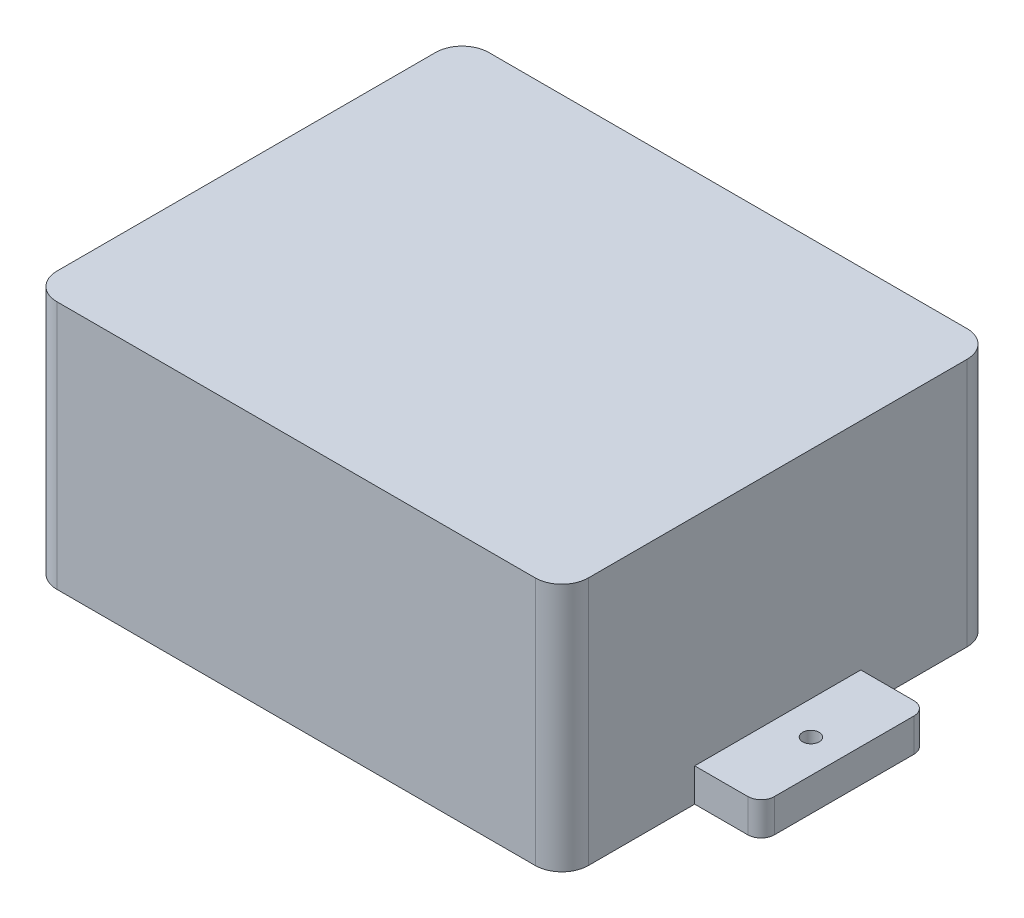
from build123d import *

# Parameters (mm, degrees)
SKETCH2_W           = 101.6
SKETCH2_H           = 82.55
BOSS_EXTRUDE1_DEPTH = 47.625
FILLET1_R           = 5.08
SKETCH4_W           = 12.7
SKETCH4_H           = 31.75
BOSS_EXTRUDE2_DEPTH = 6.35
SKETCH3_W           = 12.7
SKETCH3_H           = 31.75
BOSS_EXTRUDE3_DEPTH = 6.35
FILLET2_R           = 2.54
SKETCH5_W           = 31.75
SKETCH5_H           = 12.7
BOSS_EXTRUDE4_DEPTH = 6.35
FILLET3_R           = 2.54
SKETCH6_R           = 1.5875
CUT_EXTRUDE1_DEPTH  = 9.398
SKETCH7_R           = 1.5875
CUT_EXTRUDE2_DEPTH  = 9.398
SKETCH8_R           = 1.5875
CUT_EXTRUDE3_DEPTH  = 9.398


with BuildPart() as part:
    # Sketch2 → Boss-Extrude1 (new body)
    with BuildSketch(Plane(origin=(0, 0, 0), x_dir=(1, 0, 0), z_dir=(0, 1, 0))):
        Rectangle(SKETCH2_W, SKETCH2_H)
    extrude(amount=BOSS_EXTRUDE1_DEPTH)

    # Fillet1
    fillet1_edges = [part.edges().sort_by_distance(p)[0] for p in [
        (50.8, 23.8125, 41.275),
        (50.8, 23.8125, -41.275),
        (-50.8, 23.8125, 41.275),
        (-50.8, 23.8125, -41.275),
    ]]
    fillet(fillet1_edges, radius=FILLET1_R)

    # Sketch4 → Boss-Extrude2 (add)
    with BuildSketch(Plane(origin=(0, 0, 0), x_dir=(1, 0, 0), z_dir=(0, 1, 0))):
        with Locations((-57.15, 0)):
            Rectangle(SKETCH4_W, SKETCH4_H)
    extrude(amount=BOSS_EXTRUDE2_DEPTH)

    # Sketch3 → Boss-Extrude3 (add)
    with BuildSketch(Plane(origin=(0, 0, 0), x_dir=(1, 0, 0), z_dir=(0, 1, 0))):
        with Locations((57.15, 0)):
            Rectangle(SKETCH3_W, SKETCH3_H)
    extrude(amount=BOSS_EXTRUDE3_DEPTH)

    # Fillet2
    fillet2_edges = [part.edges().sort_by_distance(p)[0] for p in [
        (-63.5, 3.175, 15.875),
        (-63.5, 3.175, -15.875),
        (63.5, 3.175, -15.875),
        (63.5, 3.175, 15.875),
    ]]
    fillet(fillet2_edges, radius=FILLET2_R)

    # Sketch5 → Boss-Extrude4 (add)
    with BuildSketch(Plane(origin=(0, 0, 0), x_dir=(1, 0, 0), z_dir=(0, 1, 0))):
        with Locations((0, 47.625)):
            Rectangle(SKETCH5_W, SKETCH5_H)
    extrude(amount=BOSS_EXTRUDE4_DEPTH)

    # Fillet3
    fillet3_edges = [part.edges().sort_by_distance(p)[0] for p in [
        (-15.875, 3.175, -53.975),
        (15.875, 3.175, -53.975),
    ]]
    fillet(fillet3_edges, radius=FILLET3_R)

    # Sketch6 → Cut-Extrude1 (cut)
    with BuildSketch(Plane(origin=(0, 6.35, 0), x_dir=(1, 0, 0), z_dir=(0, 1, 0))):
        with Locations((0, 47.625)):
            Circle(SKETCH6_R)
    extrude(amount=-CUT_EXTRUDE1_DEPTH, mode=Mode.SUBTRACT)

    # Sketch7 → Cut-Extrude2 (cut)
    with BuildSketch(Plane(origin=(0, 6.35, 0), x_dir=(1, 0, 0), z_dir=(0, 1, 0))):
        with Locations((-57.15, 0)):
            Circle(SKETCH7_R)
    extrude(amount=-CUT_EXTRUDE2_DEPTH, mode=Mode.SUBTRACT)

    # Sketch8 → Cut-Extrude3 (cut)
    with BuildSketch(Plane(origin=(0, 6.35, 0), x_dir=(1, 0, 0), z_dir=(0, 1, 0))):
        with Locations((57.15, 0)):
            Circle(SKETCH8_R)
    extrude(amount=-CUT_EXTRUDE3_DEPTH, mode=Mode.SUBTRACT)


solid = part.part
